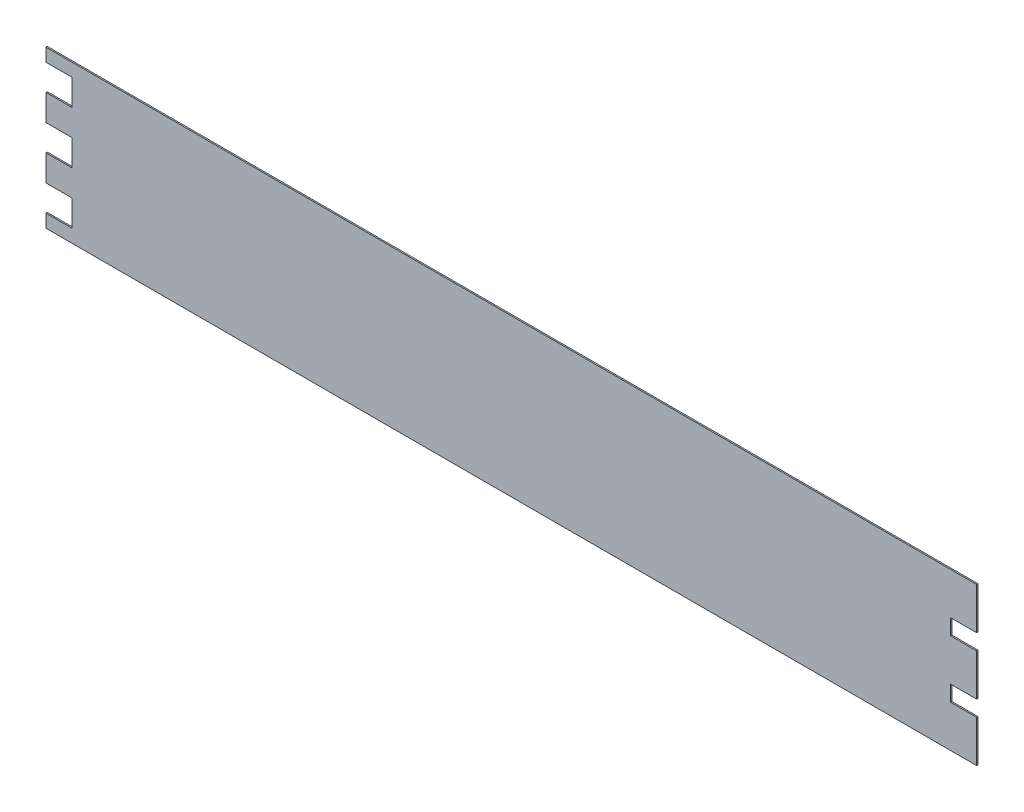
from build123d import *

# Parameters (mm, degrees)
BOSS_EXTRUDE1_DEPTH = 0.125
SKETCH3_W           = 5
SKETCH3_H           = 5
CUT_EXTRUDE1_DEPTH  = 185.889325003
LPATTERN2_COUNT     = 5
LPATTERN2_PITCH     = 10
SKETCH4_W           = 5
SKETCH4_H           = 3
CUT_EXTRUDE2_DEPTH  = 185.889325003
LPATTERN3_COUNT     = 2
LPATTERN3_PITCH     = 11
SKETCH5_W           = 178
SKETCH5_H           = 20
CUT_EXTRUDE3_DEPTH  = 185.889325003


with BuildPart() as part:
    # Sketch2 → Boss-Extrude1 (new, symmetric)
    with BuildSketch(Plane.XY):
        Polygon((0, 0), (5, 0), (173, 20), (178, 20), (178, 50), (0, 50), align=None)
    extrude(amount=BOSS_EXTRUDE1_DEPTH, both=True)

    # Sketch3 → Cut-Extrude1 (cut, through all)
    with BuildSketch(Plane.XY.offset(0.125)):
        with Locations((2.5, 45)):
            Rectangle(SKETCH3_W, SKETCH3_H)
    cut_extrude1 = extrude(amount=-CUT_EXTRUDE1_DEPTH, mode=Mode.SUBTRACT)

    # LPattern2: Cut-Extrude1 ×5
    with Locations(*[(0, -i * LPATTERN2_PITCH, 0) for i in range(1, LPATTERN2_COUNT)]):
        add(cut_extrude1, mode=Mode.SUBTRACT)

    # Sketch4 → Cut-Extrude2 (cut, through all)
    with BuildSketch(Plane.XY.offset(0.125)):
        with Locations((175.5, 40.5)):
            Rectangle(SKETCH4_W, SKETCH4_H)
    cut_extrude2 = extrude(amount=-CUT_EXTRUDE2_DEPTH, mode=Mode.SUBTRACT)

    # LPattern3: Cut-Extrude2 ×2
    with Locations(*[(0, -i * LPATTERN3_PITCH, 0) for i in range(1, LPATTERN3_COUNT)]):
        add(cut_extrude2, mode=Mode.SUBTRACT)

    # Sketch5 → Cut-Extrude3 (cut, through all)
    with BuildSketch(Plane.XY.offset(0.125)):
        with Locations((89, 10)):
            Rectangle(SKETCH5_W, SKETCH5_H)
    extrude(amount=-CUT_EXTRUDE3_DEPTH, mode=Mode.SUBTRACT)


solid = part.part
